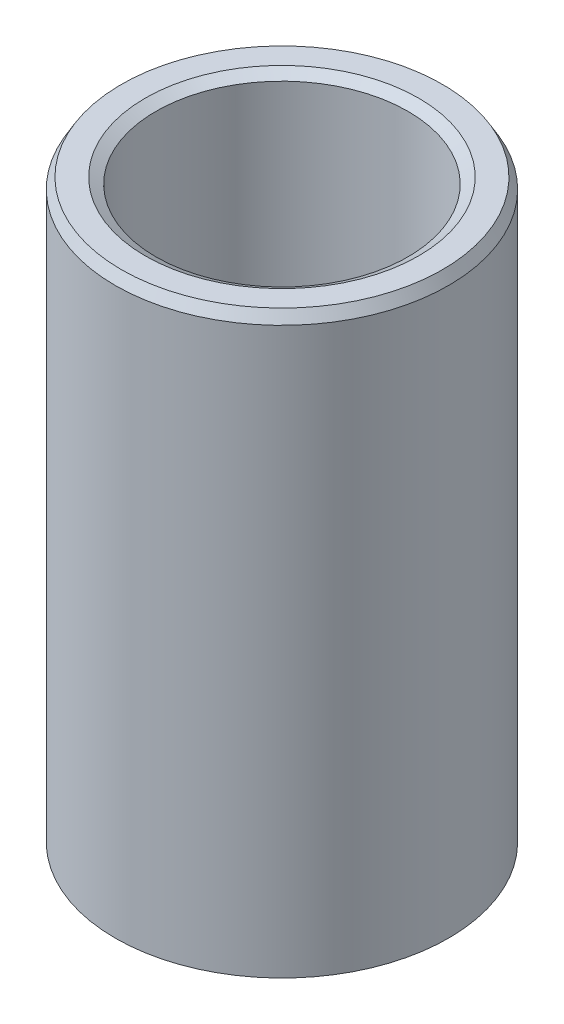
from build123d import *
from OCP.BRepFilletAPI import BRepFilletAPI_MakeChamfer

# Parameters (mm, degrees)
SKETCH1_R           = 60
BOSS_EXTRUDE1_DEPTH = 209.522164871
SKETCH2_R           = 45.385047671
CUT_EXTRUDE1_DEPTH  = 227.052068276
CHAMFER1_SIZE       = 3.823986487
CHAMFER1_SIZE2      = 2.207779627


with BuildPart() as part:
    # Sketch1 → Boss-Extrude1 (new body)
    with BuildSketch(Plane(origin=(0, 0, 0), x_dir=(1, 0, 0), z_dir=(0, 1, 0))):
        Circle(SKETCH1_R)
    extrude(amount=BOSS_EXTRUDE1_DEPTH)

    # Sketch2 → Cut-Extrude1 (cut, through all)
    with BuildSketch(Plane(origin=(0, 0, 0), x_dir=(1, 0, 0), z_dir=(0, 1, 0))):
        Circle(SKETCH2_R)
    extrude(amount=CUT_EXTRUDE1_DEPTH, mode=Mode.SUBTRACT)

    # Chamfer1: one chamfer whose edges measure the first distance from different faces: ONE call of the kernel's chamfer builder (chamfer() names one face for all edges)
    chamfer1_edges_1 = [part.edges().sort_by_distance(p)[0] for p in [
        (-45.385047671, 209.522164871, 0),
    ]]
    chamfer1_side_1 = [part.faces().sort_by_distance(p)[0] for p in [
        (-58.302943725, 209.522164871, 0),
    ]]
    chamfer1_edges_2 = [part.edges().sort_by_distance(p)[0] for p in [
        (-45.385047671, 0, 0),
    ]]
    chamfer1_side_2 = [part.faces().sort_by_distance(p)[0] for p in [
        (-45.385047671, 104.761082435, 0),
    ]]
    chamfer1_edges_3 = [part.edges().sort_by_distance(p)[0] for p in [
        (-60, 0, 0),
    ]]
    chamfer1_side_3 = [part.faces().sort_by_distance(p)[0] for p in [
        (-58.302943725, 0, 0),
    ]]
    chamfer1_edges_4 = [part.edges().sort_by_distance(p)[0] for p in [
        (-60, 209.522164871, 0),
    ]]
    chamfer1_side_4 = [part.faces().sort_by_distance(p)[0] for p in [
        (-60, 104.761082435, 0),
    ]]
    chamfer1 = BRepFilletAPI_MakeChamfer(part.part.solid().wrapped)
    for e in chamfer1_edges_1:
        chamfer1.Add(CHAMFER1_SIZE, CHAMFER1_SIZE2, e.wrapped, chamfer1_side_1[0].wrapped)  # the first distance lies on this face
    for e in chamfer1_edges_2:
        chamfer1.Add(CHAMFER1_SIZE, CHAMFER1_SIZE2, e.wrapped, chamfer1_side_2[0].wrapped)  # the first distance lies on this face
    for e in chamfer1_edges_3:
        chamfer1.Add(CHAMFER1_SIZE, CHAMFER1_SIZE2, e.wrapped, chamfer1_side_3[0].wrapped)  # the first distance lies on this face
    for e in chamfer1_edges_4:
        chamfer1.Add(CHAMFER1_SIZE, CHAMFER1_SIZE2, e.wrapped, chamfer1_side_4[0].wrapped)  # the first distance lies on this face
    add(Compound.cast(chamfer1.Shape()), mode=Mode.REPLACE)


solid = part.part
